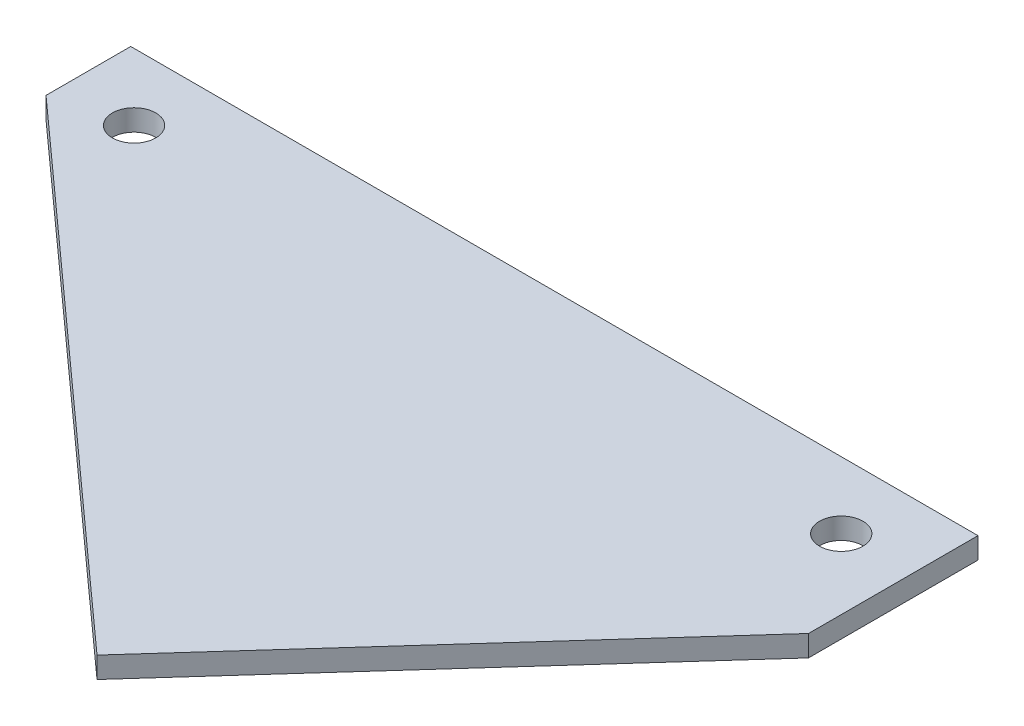
from build123d import *

# Parameters (mm, degrees)
SKETCH1_W           = 127
SKETCH1_H           = 127
BOSS_EXTRUDE1_DEPTH = 3.175
SKETCH2_R           = 3.25
CUT_EXTRUDE1_DEPTH  = 110.295656936


with BuildPart() as part:
    # Sketch1 → Boss-Extrude1 (new body)
    with BuildSketch(Plane(origin=(0, 0, 0), x_dir=(1, 0, 0), z_dir=(0, 1, 0))):
        with Locations((0, -25.4)):
            Rectangle(SKETCH1_W, SKETCH1_H)
    extrude(amount=BOSS_EXTRUDE1_DEPTH)

    # Sketch2 → Cut-Extrude1 (cut, through all)
    with BuildSketch(Plane(origin=(0, 3.175, 0), x_dir=(1, 0, 0), z_dir=(0, 1, 0))):
        Polygon((12.980662983, -43.432596685), (-63.5, 25.4), (-63.5, -88.9), (63.5, -88.9), (63.5, 12.7), align=None)
        with Locations((53, 28.1)):
            Circle(SKETCH2_R)
        with Locations((-53, 28.1)):
            Circle(SKETCH2_R)
    extrude(amount=-CUT_EXTRUDE1_DEPTH, mode=Mode.SUBTRACT)


solid = part.part
